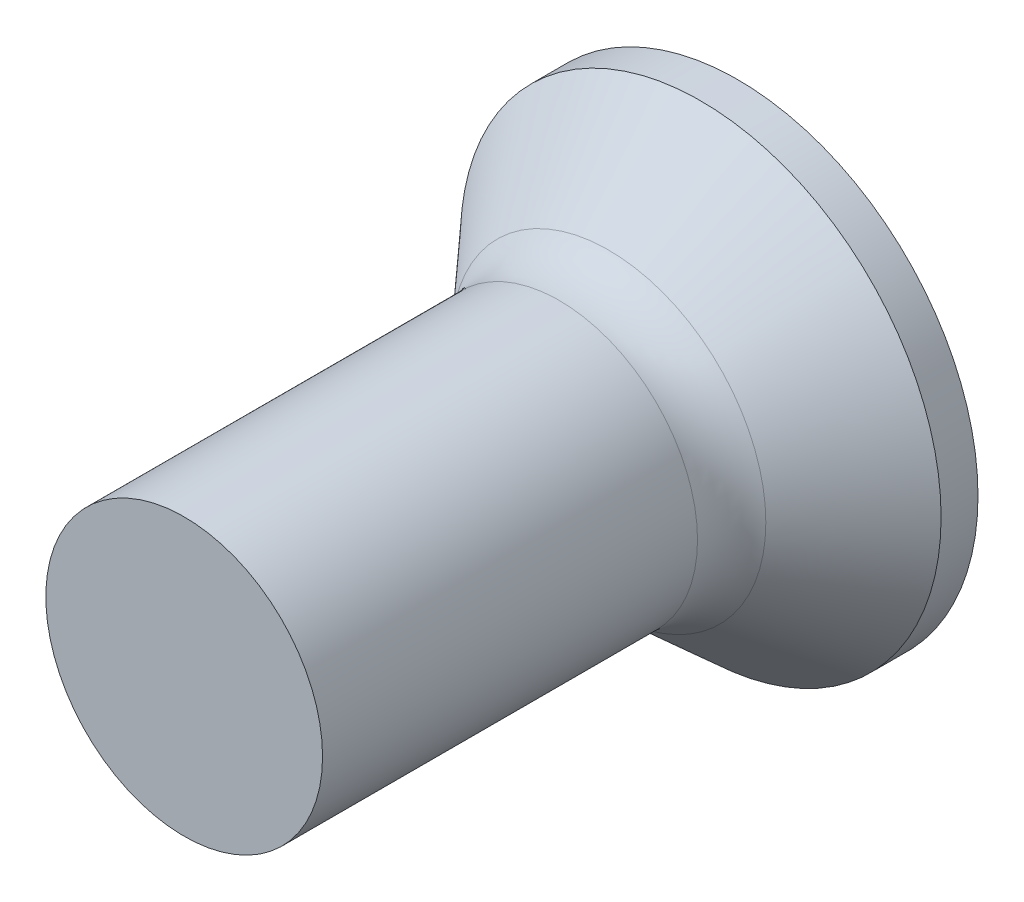
from build123d import *

# Parameters (mm, degrees)
CUT_EXTRUDE_1_DEPTH      = 0.35
PATTERN_CIRCULAR_1_COUNT = 4
SCALE_1_SCALE            = 0.5


with BuildPart() as part:
    # Эскиз1 → Повернуть1 (revolve)
    with BuildSketch(Plane(origin=(0, 0, 0), x_dir=(0, 0, -1), z_dir=(1, 0, 0))):
        with BuildLine():
            Line((-3, 0), (3, 0))
            Line((3, 0), (3, 2.605364683))
            Line((3, 2.605364683), (2.6, 2.605364683))
            Line((2.6, 2.605364683), (1.6, 1.705364683))
            ThreePointArc((1.6, 1.705364683), (1.351439228, 1.553103671), (1.064828215, 1.5))
            Line((1.064828215, 1.5), (-3, 1.5))
            Line((-3, 1.5), (-3, 0))
        make_face()
    revolve(axis=Axis((0, 0, -3), (0, 0, -1)))

    # Эскиз2 → Вырез-Вытянуть1 (cut, symmetric)
    with BuildSketch(Plane(origin=(0, 0, 0), x_dir=(0, 0, -1), z_dir=(1, 0, 0))):
        Polygon((3, 0), (3, 1.497163216), (1, 0.5), (1, 0), align=None)
    cut_extrude_1 = extrude(amount=CUT_EXTRUDE_1_DEPTH, both=True, mode=Mode.SUBTRACT)

    # Круговой массив1: Вырез-Вытянуть1 ×4 about axis
    pattern_circular_1_axis = Axis((0, 0, -3), (0, 0, 1))
    for i in range(1, PATTERN_CIRCULAR_1_COUNT):
        add(cut_extrude_1.rotate(pattern_circular_1_axis, i * 360 / PATTERN_CIRCULAR_1_COUNT), mode=Mode.SUBTRACT)

    # Эскиз3 → Вырез-Повернуть1 (revolve, cut)
    with BuildSketch(Plane(origin=(0, 0, 0), x_dir=(0, 0, -1), z_dir=(1, 0, 0))):
        Polygon((0.8, 0), (0.978705833, 0.55), (3, 0.55), (3, 0), align=None)
    revolve(axis=Axis((0, 0, 0), (0, 0, -1)), mode=Mode.SUBTRACT)


with BuildPart() as part_1:
    # Масштаб1: scaled about (0, 0, -0.455622057)
    add(part.part.scale(SCALE_1_SCALE).moved(Location((0, 0, -0.227811029))))


solid = part_1.part
